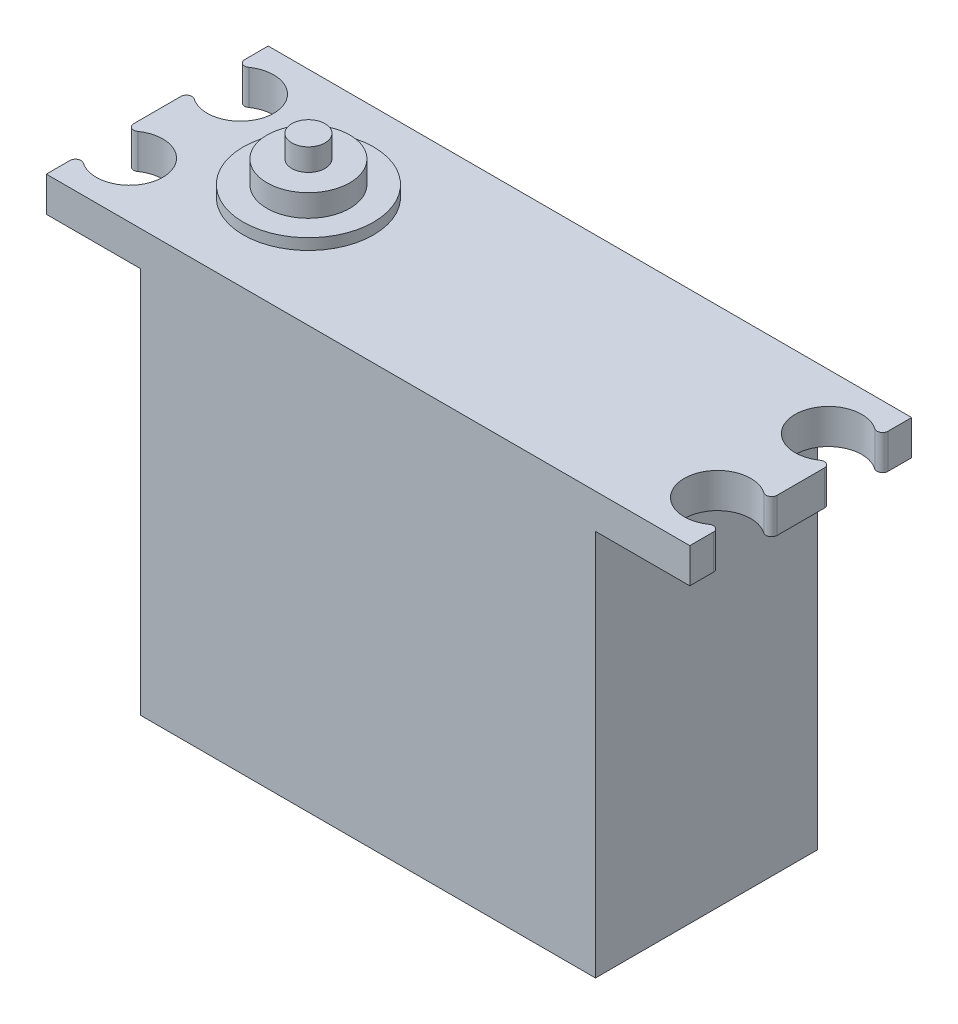
from build123d import *

# Parameters (mm, degrees)
BOSS_EXTRUDE1_DEPTH = 20
SKETCH2_R           = 3
CUT_EXTRUDE2_DEPTH  = 52.816985632
FILLET1_R           = 0.5
SKETCH4_R           = 5.872078672
BOSS_EXTRUDE2_DEPTH = 1
SKETCH5_R           = 3.732814836
BOSS_EXTRUDE3_DEPTH = 2
SKETCH8_R           = 1.5
BOSS_EXTRUDE4_DEPTH = 2


with BuildPart() as part:
    # Sketch1 → Boss-Extrude1 (new body)
    with BuildSketch(Plane.XY):
        Polygon((-29, 19), (29, 19), (29, 15.862733035), (20.5, 15.862733035), (20.5, -19), (-20.5, -19), (-20.5, 15.862733035), (-29, 15.862733035), align=None)
    extrude(amount=-BOSS_EXTRUDE1_DEPTH)

    # Sketch2 → Cut-Extrude2 (cut, through all)
    with BuildSketch(Plane(origin=(0, 19, 0), x_dir=(1, 0, 0), z_dir=(0, 1, 0))):
        with Locations((26.5, 5)):
            Circle(SKETCH2_R)
        with Locations((26.5, 15)):
            Circle(SKETCH2_R)
        with Locations((-26.5, 5)):
            Circle(SKETCH2_R)
        with Locations((-26.5, 15)):
            Circle(SKETCH2_R)
    extrude(amount=-CUT_EXTRUDE2_DEPTH, mode=Mode.SUBTRACT)

    # Fillet1
    fillet1_edges = [part.edges().sort_by_distance(p)[0] for p in [
        (-29, 17.431366518, -16.658312395),
        (-29, 17.431366518, -13.341687605),
        (-29, 17.431366518, -6.658312395),
        (-29, 17.431366518, -3.341687605),
        (29, 17.431366518, -13.341687605),
        (29, 17.431366518, -16.658312395),
        (29, 17.431366518, -6.658312395),
        (29, 17.431366518, -3.341687605),
    ]]
    fillet(fillet1_edges, radius=FILLET1_R)

    # Sketch4 → Boss-Extrude2 (add)
    with BuildSketch(Plane(origin=(0, 19, 0), x_dir=(1, 0, 0), z_dir=(0, 1, 0))):
        with Locations((-15.375793184, 10)):
            Circle(SKETCH4_R)
    extrude(amount=BOSS_EXTRUDE2_DEPTH)

    # Sketch5 → Boss-Extrude3 (add)
    with BuildSketch(Plane(origin=(0, 20, 0), x_dir=(1, 0, 0), z_dir=(0, 1, 0))):
        with Locations((-15.375793184, 10)):
            Circle(SKETCH5_R)
    extrude(amount=BOSS_EXTRUDE3_DEPTH)

    # Sketch8 → Boss-Extrude4 (add)
    with BuildSketch(Plane(origin=(0, 22, 0), x_dir=(1, 0, 0), z_dir=(0, 1, 0))):
        with Locations((-15.375793184, 10)):
            Circle(SKETCH8_R)
    extrude(amount=BOSS_EXTRUDE4_DEPTH)


solid = part.part
